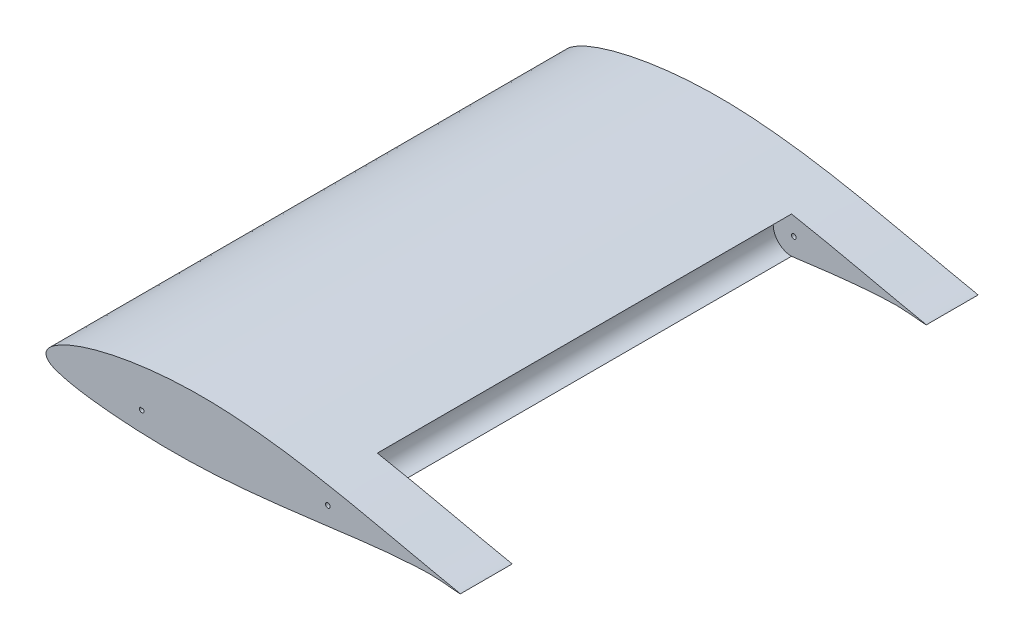
from build123d import *

# Parameters (mm, degrees)
BOSS_EXTRU_6_DEPTH           = 250
ENL_V_START                  = -3.818852571
ENL_V_MAT_EXTRU_2_OUTLINE_W  = 67.03813579
ENL_V_MAT_EXTRU_2_OUTLINE_H  = 200
ENL_V_MAT_EXTRU_2_DEPTH      = 17.694741424
ESQUISSE13_R                 = 1.125
ENL_V_MAT_EXTRU_5_DEPTH      = 20
ENL_V_START_2                = -187
ESQUISSE15_R                 = 1.125
ENL_V_MAT_EXTRU_6_DEPTH      = 187
ENL_V_MAT_EXTRU_7_DEPTH      = 12
ENL_V_MAT_EXTRU_7_DEPTH_BACK = 10
ENL_V_MAT_EXTRU_9_DEPTH      = 18
ENL_V_START_3                = -20
ENL_V_MAT_EXTRU_10_DEPTH     = 20


# Read off the part's stored shape, not the designer's step: Enlèv. mat.-Extru.2
with BuildPart() as part:
    # Esquisse8 → Boss.-Extru.6 (new body)
    with BuildSketch(Plane.XY):
        with BuildLine():
            add(Edge.make_bspline(
                [(200, 0), (200.0524909, 0.197320712), (188.495199231, 2.470567557), (180.506029755, 4.263470399), (170.025344855, 6.570151311), (160.197966692, 8.733545461), (150.176379186, 10.878813532), (140.185237854, 12.906912473), (130.164185889, 14.781252235), (120.128168111, 16.442868525), (110.077896986, 17.866436542), (100.009710205, 18.956672156), (89.938189069, 19.806540059), (79.851020454, 20.224218097), (69.758640951, 20.22613229), (59.665340321, 19.755227619), (49.575017862, 18.826794216), (39.488479045, 17.405152233), (29.402037935, 15.445117567), (21.035849324, 13.242487862), (14.379164897, 10.988632164), (9.34737318, 8.907863286), (5.187942315, 6.69765387), (2.45559706, 4.723331471), (1.246189368, 3.464331473), (0.25822787, 2.170571237), (-0.448591431, -0.005343519), (0.831394371, -1.812607749), (2.001078057, -2.718440078), (3.360489806, -3.50665812), (6.246695041, -4.622060401), (10.491641903, -5.74174331), (15.537796062, -6.747440435), (22.199128805, -7.759786543), (30.504580901, -8.670634888), (40.457428707, -9.414450814), (50.392707109, -9.840863878), (60.314106476, -10.005329353), (70.235693785, -9.897487511), (80.155528067, -9.487770879), (90.08232775, -8.819918176), (100.010839538, -7.93656882), (109.948564497, -6.886596484), (119.89066203, -5.684387584), (129.863880471, -4.538896789), (139.826822619, -3.134197214), (149.812737654, -1.895524658), (159.857438102, -0.743307562), (169.742958446, 0.248078087), (180.30028603, 0.858673753), (188.449352245, 1.251175045), (199.94810091, -0.195096015), (200, 0)],
                knots=[0, 0, 0, 0, 0.024850779, 0.049657358, 0.074515028, 0.099399485, 0.124298501, 0.149177646, 0.174026702, 0.198826695, 0.22356852, 0.248243143, 0.272875421, 0.297467782, 0.32204858, 0.346655773, 0.371331731, 0.39612295, 0.42111452, 0.446435553, 0.459316643, 0.472483758, 0.486218457, 0.493670662, 0.4970251, 0.498914754, 0.505643859, 0.511860986, 0.513528474, 0.516514374, 0.523288776, 0.53609297, 0.548571376, 0.560904932, 0.585353061, 0.609651253, 0.633879868, 0.658064137, 0.682206742, 0.706428122, 0.730657743, 0.754956934, 0.779316031, 0.803731736, 0.828189954, 0.852729091, 0.877285905, 0.901844041, 0.926398924, 0.950926612, 0.975429401, 1, 1, 1, 1], degree=3))
        make_face()
    extrude(amount=BOSS_EXTRU_6_DEPTH)

    # Enlèv. mat.-Extru.2 outline → Enlèv. mat.-Extru.2 (cut)
    with BuildSketch(Plane(origin=(0, 0, 0), x_dir=(1, 0, 0), z_dir=(0, 1, 0)).offset(ENL_V_START)):
        with Locations((168.480932105, -125)):
            Rectangle(ENL_V_MAT_EXTRU_2_OUTLINE_W, ENL_V_MAT_EXTRU_2_OUTLINE_H)
    extrude(amount=ENL_V_MAT_EXTRU_2_DEPTH, mode=Mode.SUBTRACT)

    # Esquisse12 → Enlèvement de matière-Révolution1 (revolve, cut)
    with BuildSketch(Plane(origin=(134.96186421, 0, 0), x_dir=(0, 0, -1), z_dir=(1, 0, 0))):
        Polygon((-225, 13.875888853), (-225, 5.02851819), (-25, 5.02851819), (-25, 13.875888851), align=None)
    revolve(axis=Axis((134.96186421, 5.02851819, 225), (0, 0, -1)), mode=Mode.SUBTRACT)

    # Esquisse13 → Enlèv. mat.-Extru.5 (cut)
    with BuildSketch(Plane.XY.offset(25)):
        with Locations((136.08686421, 5.02851819)):
            Circle(ESQUISSE13_R)
    extrude(amount=-ENL_V_MAT_EXTRU_5_DEPTH, mode=Mode.SUBTRACT)

    # Esquisse15 → Enlèv. mat.-Extru.6 (cut)
    with BuildSketch(Plane(origin=(0, 0, 225), x_dir=(-1, 0, 0), z_dir=(0, 0, -1)).offset(ENL_V_START_2)):
        with Locations(Location((-136.08686421, 5.02851819, 0), (0, 0, 180))):
            Circle(ESQUISSE15_R)
    extrude(amount=ENL_V_MAT_EXTRU_6_DEPTH, mode=Mode.SUBTRACT)

    # Esquisse16 → Enlèv. mat.-Extru.7 (cut, two sides: drawn at the far end of the back side and taken through both)
    with BuildSketch(Plane(origin=(0, 0, 0), x_dir=(1, 0, 0), z_dir=(0, 1, 0)).offset(-ENL_V_MAT_EXTRU_7_DEPTH_BACK)):
        Polygon((104.96186421, -124.807948398), (66.96186421, -124.807948398), (66.96186421, -147.807948398), (61.96186421, -147.807948398), (61.96186421, -150.807948398), (66.96186421, -150.807948398), (66.96186421, -159.807948398), (85.96186421, -159.807948398), (85.96186421, -165.807948398), (104.96186421, -165.807948398), (104.96186421, -157.807948398), (104.96186421, -150.807948398), (109.96186421, -150.807948398), (109.96186421, -147.807948398), (104.96186421, -147.807948398), align=None)
    extrude(amount=ENL_V_MAT_EXTRU_7_DEPTH + ENL_V_MAT_EXTRU_7_DEPTH_BACK, mode=Mode.SUBTRACT)

    # Esquisse19 → Enlèv. mat.-Extru.9 (cut)
    with BuildSketch(Plane.XY.offset(250)):
        with BuildLine():
            Line((45.45, 0.838525492), (46.95, 0.838525492))
            ThreePointArc((46.95, 0.838525492), (46.2, -1.125), (45.45, 0.838525492))
        make_face()
    extrude(amount=-ENL_V_MAT_EXTRU_9_DEPTH, mode=Mode.SUBTRACT)

    # Esquisse22 → Enlèv. mat.-Extru.10 (cut)
    with BuildSketch(Plane(origin=(0, 0, 0), x_dir=(-1, 0, 0), z_dir=(0, 0, -1)).offset(ENL_V_START_3)):
        with BuildLine():
            Line((-46.95, 0.838525492), (-45.45, 0.838525492))
            ThreePointArc((-45.45, 0.838525492), (-46.2, -1.125), (-46.95, 0.838525492))
        make_face()
    extrude(amount=ENL_V_MAT_EXTRU_10_DEPTH, mode=Mode.SUBTRACT)


solid = part.part
